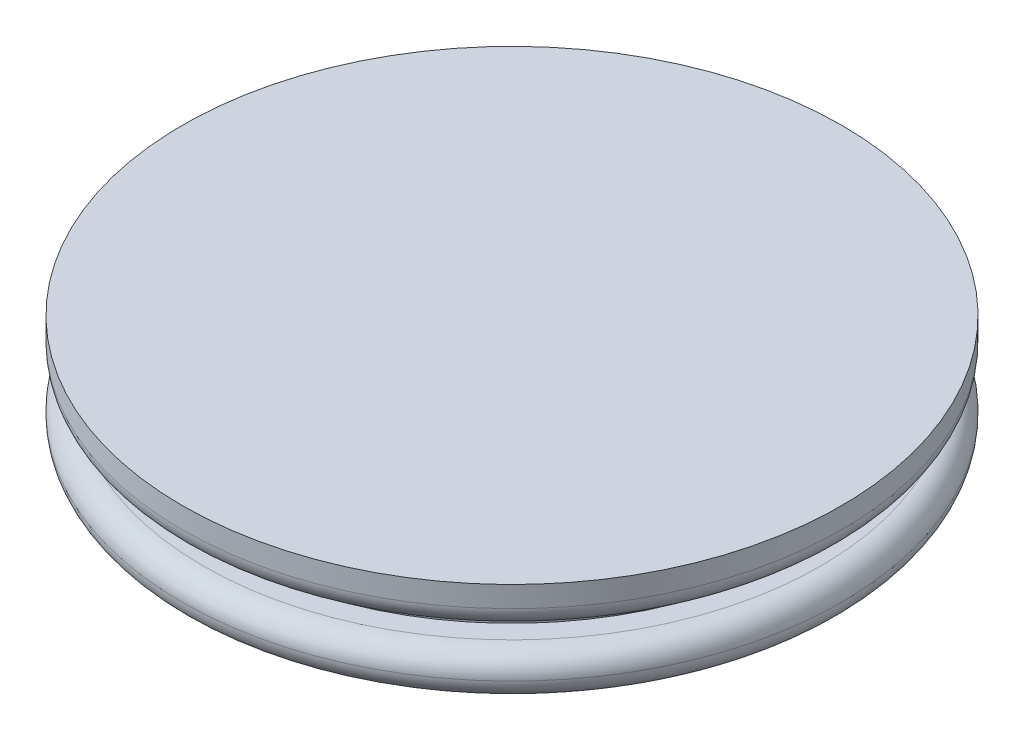
from build123d import *

# Parameters (mm, degrees)
SKETCH1_R           = 20
BOSS_EXTRUDE1_DEPTH = 2.54
SKETCH2_R           = 17.5
BOSS_EXTRUDE2_DEPTH = 1.27
SKETCH3_R           = 20
BOSS_EXTRUDE3_DEPTH = 2.54
FILLET1_R           = 1.27
FILLET2_R           = 1.27


with BuildPart() as part:
    # Sketch1 → Boss-Extrude1 (new body)
    with BuildSketch(Plane(origin=(0, 0, 0), x_dir=(1, 0, 0), z_dir=(0, 1, 0))):
        with Locations(Location((0, 0, 0), (0, 0, 270))):
            Circle(SKETCH1_R)
    extrude(amount=BOSS_EXTRUDE1_DEPTH)

    # Sketch2 → Boss-Extrude2 (add)
    with BuildSketch(Plane(origin=(0, 2.54, 0), x_dir=(1, 0, 0), z_dir=(0, 1, 0))):
        with Locations(Location((0, 0, 0), (0, 0, 270))):
            Circle(SKETCH2_R)
    extrude(amount=BOSS_EXTRUDE2_DEPTH)

    # Sketch3 → Boss-Extrude3 (add)
    with BuildSketch(Plane(origin=(0, 3.81, 0), x_dir=(1, 0, 0), z_dir=(0, 1, 0))):
        with Locations(Location((0, 0, 0), (0, 0, 270))):
            Circle(SKETCH3_R)
    extrude(amount=BOSS_EXTRUDE3_DEPTH)

    # Fillet1
    fillet1_edges = [part.edges().sort_by_distance(p)[0] for p in [
        (0, 3.81, -20),
    ]]
    fillet(fillet1_edges, radius=FILLET1_R)

    # Fillet2
    fillet2_edges = [part.edges().sort_by_distance(p)[0] for p in [
        (0, 0, -20),
        (0, 2.54, -20),
    ]]
    fillet(fillet2_edges, radius=FILLET2_R - 0.0001)  # a hair under: the kernel refuses the full size


solid = part.part
